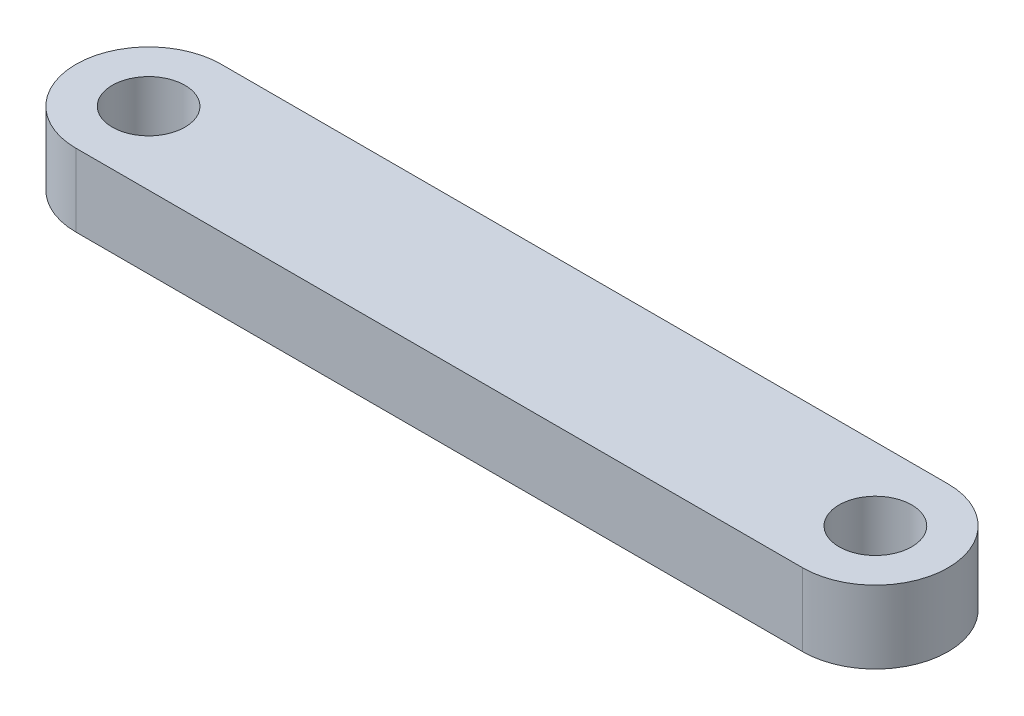
from build123d import *

# Parameters (mm, degrees)
SKETCH1_R           = 50
BOSS_EXTRUDE1_DEPTH = 50


with BuildPart() as part:
    # Sketch1 → Boss-Extrude1 (new, symmetric)
    with BuildSketch(Plane(origin=(0, 0, 0), x_dir=(1, 0, 0), z_dir=(0, 1, 0))):
        with BuildLine():
            Line((-500, 100), (500, 100))
            ThreePointArc((500, 100), (600, 0), (500, -100))
            Line((500, -100), (-500, -100))
            ThreePointArc((-500, -100), (-600, 0), (-500, 100))
        make_face()
        with Locations((-500, 0)):
            Circle(SKETCH1_R, mode=Mode.SUBTRACT)
        with Locations((500, 0)):
            Circle(SKETCH1_R, mode=Mode.SUBTRACT)
    extrude(amount=BOSS_EXTRUDE1_DEPTH, both=True)


solid = part.part
